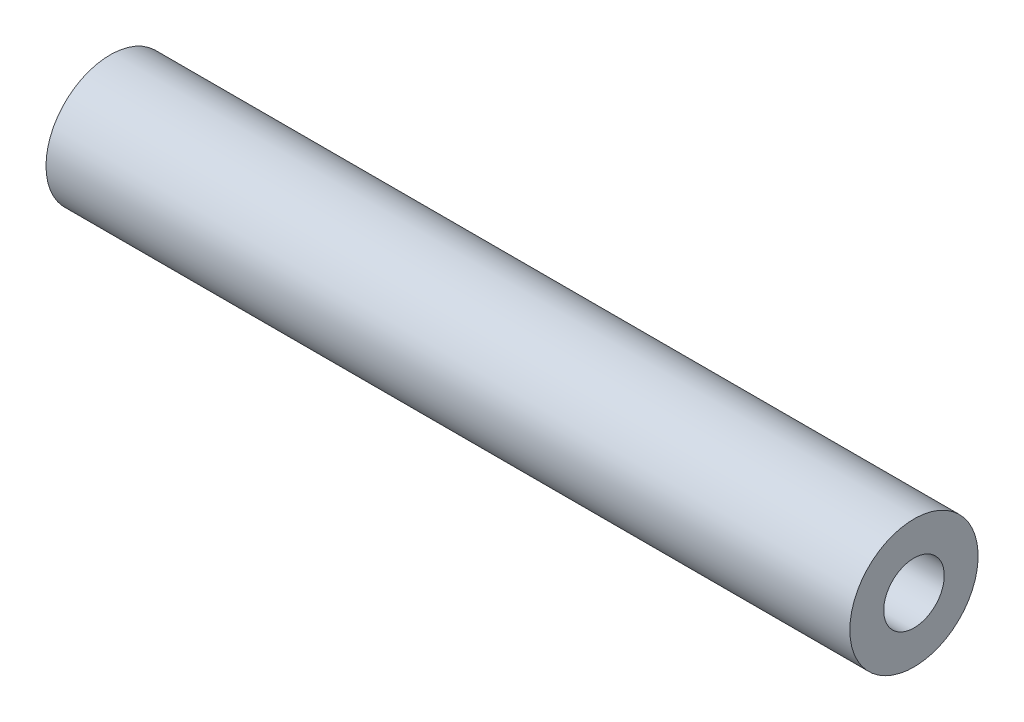
from build123d import *

# Parameters (mm, degrees)
SKETCH1_R              = 4.7625
BOSS_EXTRUDE1_DEPTH    = 59.69
F_12_24_TAPPED_HOLE1_D = 4.4958


with BuildPart() as part:
    # Sketch1 → Boss-Extrude1 (new body)
    with BuildSketch(Plane(origin=(0, 0, 0), x_dir=(0, 0, -1), z_dir=(1, 0, 0))):
        Circle(SKETCH1_R)
    extrude(amount=BOSS_EXTRUDE1_DEPTH)

    # #12-24 Tapped Hole1 (through all)
    with Locations(Plane(origin=(59.69, 0, 0), x_dir=(0, 0, -1), z_dir=(1, 0, 0))):
        with Locations((0, 0)):
            Hole(F_12_24_TAPPED_HOLE1_D / 2)


solid = part.part
